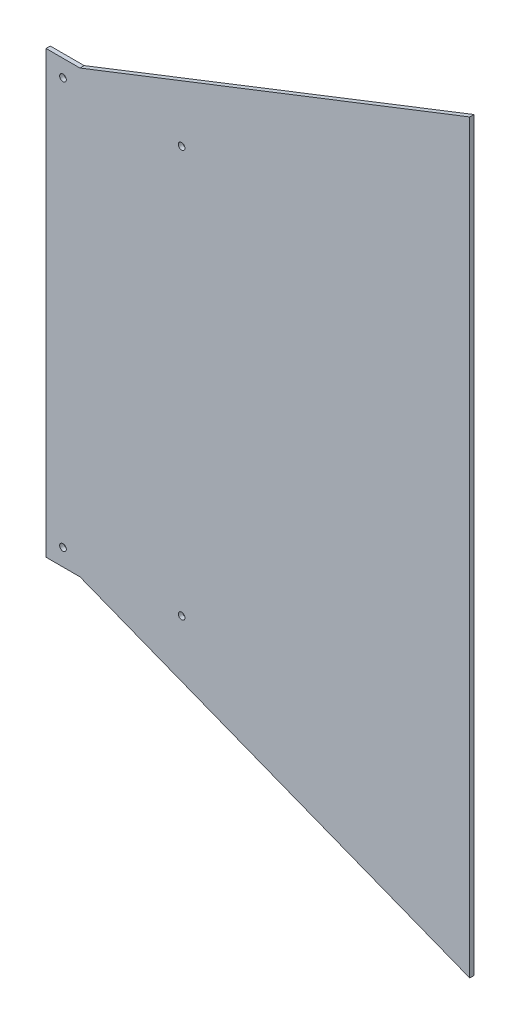
from build123d import *

# Parameters (mm, degrees)
BOSS_EXTRUDE1_DEPTH        = 3.175
F_9_0_196_DIAMETER_HOLE1_D = 4.9784


with BuildPart() as part:
    # Sketch1 → Boss-Extrude1 (new body)
    with BuildSketch(Plane(origin=(0, 0, 0), x_dir=(0, 1, 0), z_dir=(0, 0, 1))):
        Polygon((-330.2, -25.4), (-330.2, 0), (0, 0), (0, -25.4), (114.3, -317.5), (-444.5, -317.5), align=None)
    extrude(amount=BOSS_EXTRUDE1_DEPTH)

    # #9 (0.196) Diameter Hole1 (through all)
    with Locations(Plane(origin=(0, 0, 0), x_dir=(1, 0, 0), z_dir=(0, 0, -1))):
        with Locations((12.7, 317.5), (12.7, 12.7), (101.6, 317.5), (101.6, 12.7)):
            Hole(F_9_0_196_DIAMETER_HOLE1_D / 2)


solid = part.part
